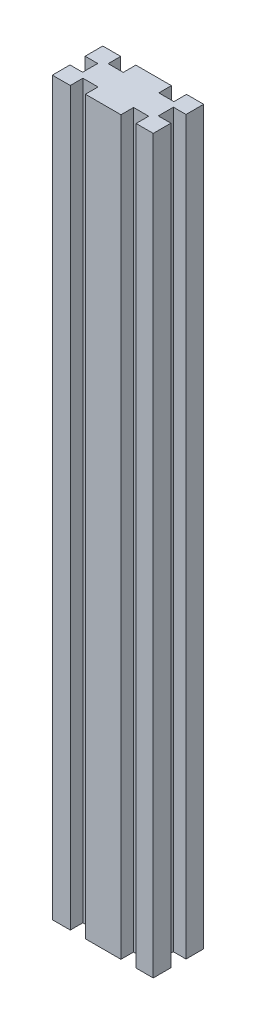
from build123d import *

# Parameters (mm, degrees)
EXTRUDE_1_DEPTH = 290


with BuildPart() as part:
    # Эскиз1 → Бобышка-Вытянуть1 (new body)
    with BuildSketch(Plane(origin=(0, 0, 0), x_dir=(1, 0, 0), z_dir=(0, 1, 0))):
        Polygon((0, 0), (7.114503097, 0), (7.114503097, 5), (13.114503097, 5), (13.114503097, 0), (27.202449332, 0), (27.202449332, 5), (33.202449332, 5), (33.202449332, 0), (40, 0), (40, 7), (35, 7), (35, 13), (40, 13), (40, 20), (33.202449332, 20), (33.202449332, 15), (27.202449332, 15), (27.202449332, 20), (13.114503097, 20), (13.114503097, 15), (7.114503097, 15), (7.114503097, 20), (0, 20), (0, 13), (5, 13), (5, 7), (0, 7), align=None)
    extrude(amount=EXTRUDE_1_DEPTH)


solid = part.part
